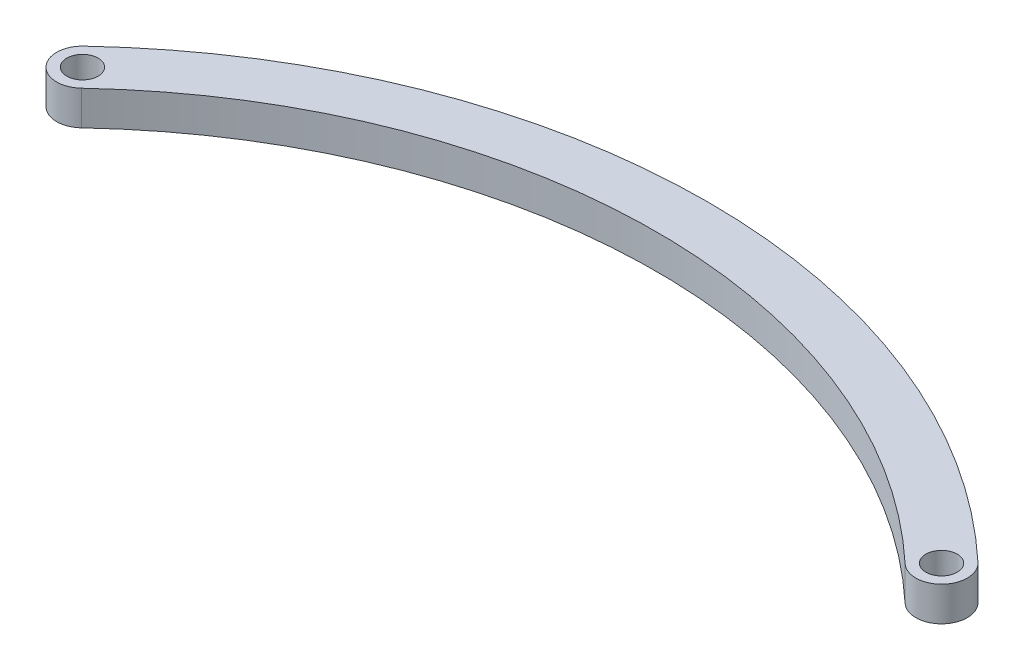
from build123d import *

# Parameters (mm, degrees)
ESQUISSE1_R        = 1.825
BOSS_EXTRU_1_DEPTH = 4


with BuildPart() as part:
    # Esquisse1 → Boss.-Extru.1 (new body)
    with BuildSketch(Plane(origin=(0, 0, 0), x_dir=(1, 0, 0), z_dir=(0, 1, 0))):
        with BuildLine():
            ThreePointArc((-52.054794536, 2.185822365), (-52.185822369, -2.054794533), (-47.945205471, -2.185822372))
            ThreePointArc((-47.945205471, -2.185822372), (-1.4e-08, 16.811655412), (47.94520545, -2.185822352))
            ThreePointArc((47.94520545, -2.185822352), (52.185822338, -2.054794566), (52.054794582, 2.185822323))
            ThreePointArc((52.054794582, 2.185822323), (3.1e-08, 22.811655412), (-52.054794536, 2.185822365))
        make_face()
        with Locations((-50, 0)):
            Circle(ESQUISSE1_R, mode=Mode.SUBTRACT)
        with Locations((50, 0)):
            Circle(ESQUISSE1_R, mode=Mode.SUBTRACT)
    extrude(amount=BOSS_EXTRU_1_DEPTH)


solid = part.part
